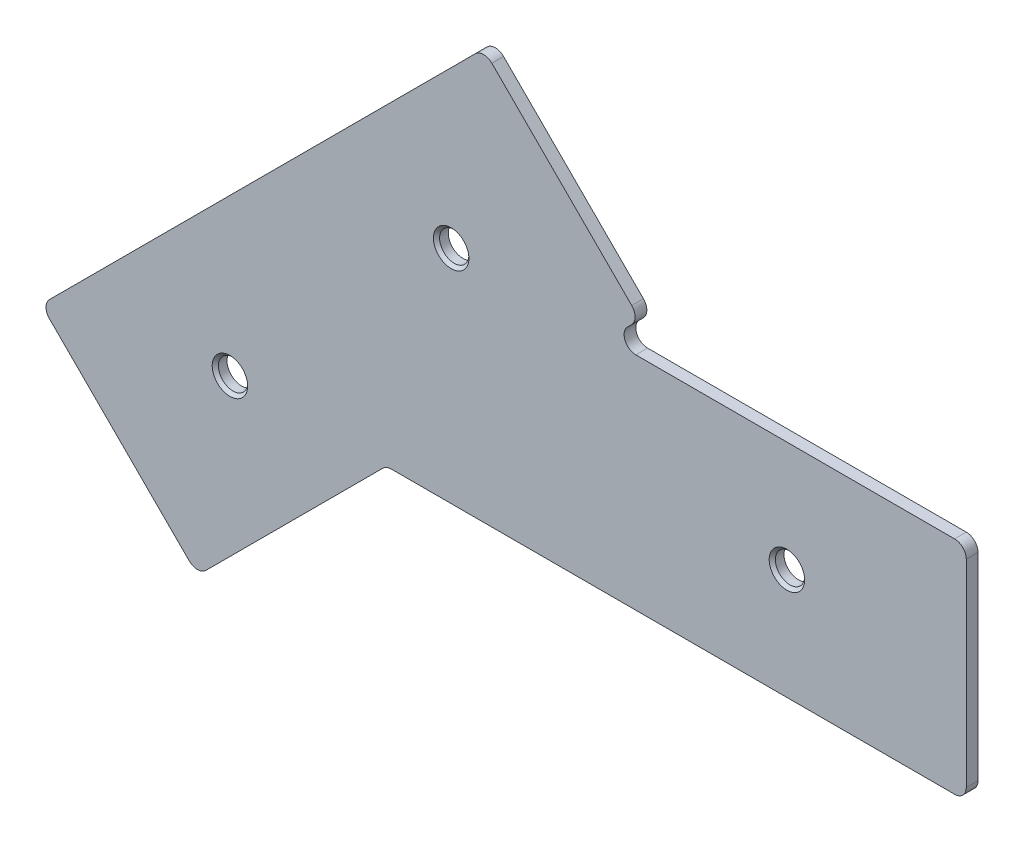
from build123d import *

# Parameters (mm, degrees)
BASE_FLANGE1_DEPTH              = 2
M6X1_0_TAPPED_HOLE1_D           = 5
M6X1_0_TAPPED_HOLE1_DEPTH       = 15
M6X1_0_TAPPED_HOLE1_CSINK_D     = 6.05
M6X1_0_TAPPED_HOLE1_CSINK_ANGLE = 90
M6X1_0_TAPPED_HOLE1_TIP         = 1.502151548
FILLET1_R                       = 2


# Sheet-metal steps are written as plain solids
with BuildPart() as part:
    # Sketch1 → Base-Flange1 (new body)
    with BuildSketch(Plane.XY):
        Polygon((13.346640495, -13.346640495), (45.577783105, 18.884502115), (144.559502115, 18.884502115), (144.559502115, 56.634502115), (83.327783105, 56.634502115), (88.865644726, 62.172363736), (62.172363736, 88.865644726), (-13.346640495, 13.346640495), align=None)
    extrude(amount=-BASE_FLANGE1_DEPTH)

    # M6x1.0 Tapped Hole1
    with Locations(Plane.XY):
        with Locations((56.639253173, 56.639253173), (18.879751058, 18.879751058), (113.94364261, 37.759502115)):
            CounterSinkHole(M6X1_0_TAPPED_HOLE1_D / 2, M6X1_0_TAPPED_HOLE1_CSINK_D / 2, depth=M6X1_0_TAPPED_HOLE1_DEPTH, counter_sink_angle=M6X1_0_TAPPED_HOLE1_CSINK_ANGLE)
            with Locations((0, 0, -(M6X1_0_TAPPED_HOLE1_DEPTH + M6X1_0_TAPPED_HOLE1_TIP / 2))):  # 118° drill point
                Cone(0, M6X1_0_TAPPED_HOLE1_D / 2, M6X1_0_TAPPED_HOLE1_TIP, mode=Mode.SUBTRACT)

    # Fillet1
    fillet1_edges = [part.edges().sort_by_distance(p)[0] for p in [
        (-13.346640495, 13.346640495, -1),
        (62.172363736, 88.865644726, -1),
        (88.865644726, 62.172363736, -1),
        (83.327783105, 56.634502115, -1),
        (144.559502115, 56.634502115, -1),
        (144.559502115, 18.884502115, -1),
        (45.577783105, 18.884502115, -1),
        (13.346640495, -13.346640495, -1),
    ]]
    fillet(fillet1_edges, radius=FILLET1_R)


solid = part.part
